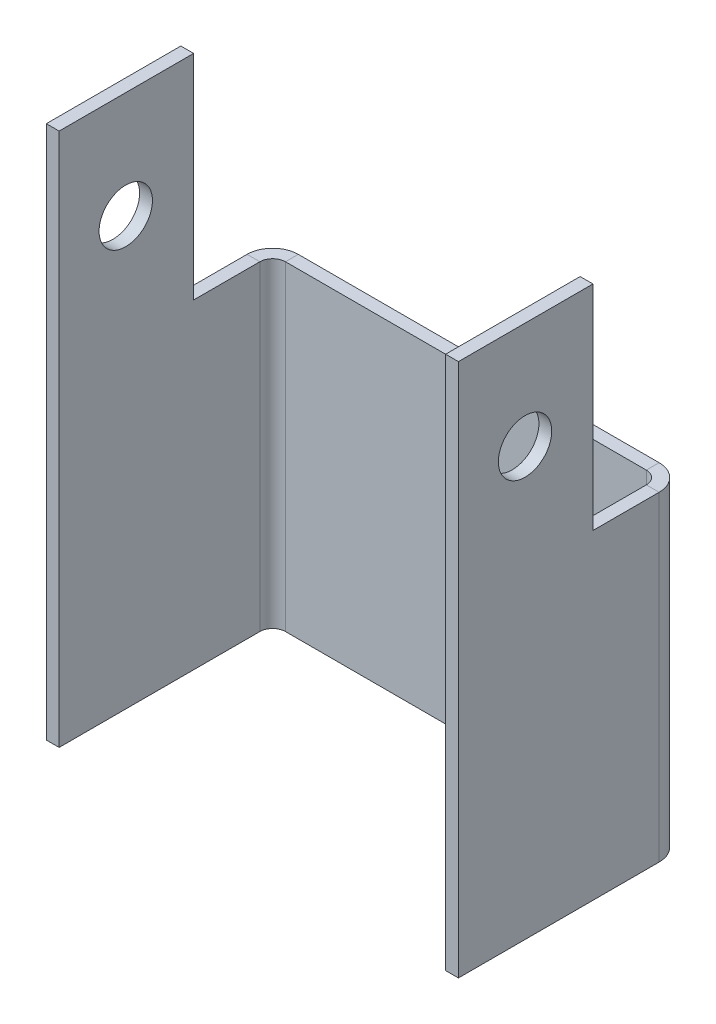
from build123d import *

# Parameters (mm, degrees)
CROQUIS1_W                         = 49.022
CROQUIS1_H                         = 63.5
BRIDA_BASE1_DEPTH                  = 1.524
BRIDA_DE_ARISTA1_STRIP_W           = 9.144
BRIDA_DE_ARISTA1_STRIP_H           = 1.524
BRIDA_DE_ARISTA1_STRIP_CUT_DEPTH   = 63.5
BRIDA_DE_ARISTA1_STRIP_2_W         = 9.144
BRIDA_DE_ARISTA1_STRIP_2_H         = 1.524
BRIDA_DE_ARISTA1_STRIP_CUT_2_DEPTH = 63.5
BRIDA_DE_ARISTA1_DEPTH             = 63.5
BRIDA_DE_ARISTA1_BEND_DEPTH        = 63.5
CROQUIS23_R                        = 3.175
CROQUIS23_W                        = 10.922
CROQUIS23_H                        = 25.4
CORTAR_EXTRUIR4_DEPTH              = 73.66


# Sheet-metal steps are written as plain solids
with BuildPart() as part:
    # Croquis1 → Brida base1 (new body)
    with BuildSketch(Plane.XY):
        Rectangle(CROQUIS1_W, CROQUIS1_H)
    extrude(amount=-BRIDA_BASE1_DEPTH)

    # Brida de arista1 strip (across the edge) → Brida de arista1 strip cut (cut)
    with BuildSketch(Plane(origin=(24.511, -31.75, 0), x_dir=(-1, 0, 0), z_dir=(0, 1, 0))):
        with Locations((-1.524, -0.762)):
            Rectangle(BRIDA_DE_ARISTA1_STRIP_W, BRIDA_DE_ARISTA1_STRIP_H)
    extrude(amount=BRIDA_DE_ARISTA1_STRIP_CUT_DEPTH, mode=Mode.SUBTRACT)

    # Brida de arista1 strip 2 (across the edge) → Brida de arista1 strip cut 2 (cut)
    with BuildSketch(Plane(origin=(-24.511, 31.75, 0), x_dir=(1, 0, 0), z_dir=(0, -1, 0))):
        with Locations((-1.524, -0.762)):
            Rectangle(BRIDA_DE_ARISTA1_STRIP_2_W, BRIDA_DE_ARISTA1_STRIP_2_H)
    extrude(amount=BRIDA_DE_ARISTA1_STRIP_CUT_2_DEPTH, mode=Mode.SUBTRACT)

    # Brida de arista1 section (across the edge) → Brida de arista1 (add)
    with BuildSketch(Plane(origin=(24.511, -31.75, 0), x_dir=(-1, 0, 0), z_dir=(0, 1, 0))):
        with BuildLine():
            Line((0, 1.524), (0, 25.4))
            Line((0, 25.4), (1.524, 25.4))
            Line((1.524, 25.4), (1.524, 1.524))
            ThreePointArc((1.524, 1.524), (1.970369265, 0.446369265), (3.048, 0))
            Line((3.048, 0), (3.048, -1.524))
            ThreePointArc((3.048, -1.524), (0.892738531, -0.631261469), (0, 1.524))
        make_face()
    extrude(amount=BRIDA_DE_ARISTA1_DEPTH)

    # Brida de arista1 section 2 (across the edge) → Brida de arista1 bend (add)
    with BuildSketch(Plane(origin=(-24.511, 31.75, 0), x_dir=(1, 0, 0), z_dir=(0, -1, 0))):
        with BuildLine():
            Line((0, 1.524), (0, 25.4))
            Line((0, 25.4), (1.524, 25.4))
            Line((1.524, 25.4), (1.524, 1.524))
            ThreePointArc((1.524, 1.524), (1.970369265, 0.446369265), (3.048, 0))
            Line((3.048, 0), (3.048, -1.524))
            ThreePointArc((3.048, -1.524), (0.892738531, -0.631261469), (0, 1.524))
        make_face()
    extrude(amount=BRIDA_DE_ARISTA1_BEND_DEPTH)

    # Croquis23 → Cortar-Extruir4 (cut)
    with BuildSketch(Plane(origin=(24.511, 0, 0), x_dir=(0, 0, -1), z_dir=(1, 0, 0))):
        with Locations((-17.4752, 19.05)):
            Circle(CROQUIS23_R)
        with Locations((-3.937, 19.05)):
            Rectangle(CROQUIS23_W, CROQUIS23_H)
    extrude(amount=-CORTAR_EXTRUIR4_DEPTH, mode=Mode.SUBTRACT)


solid = part.part
